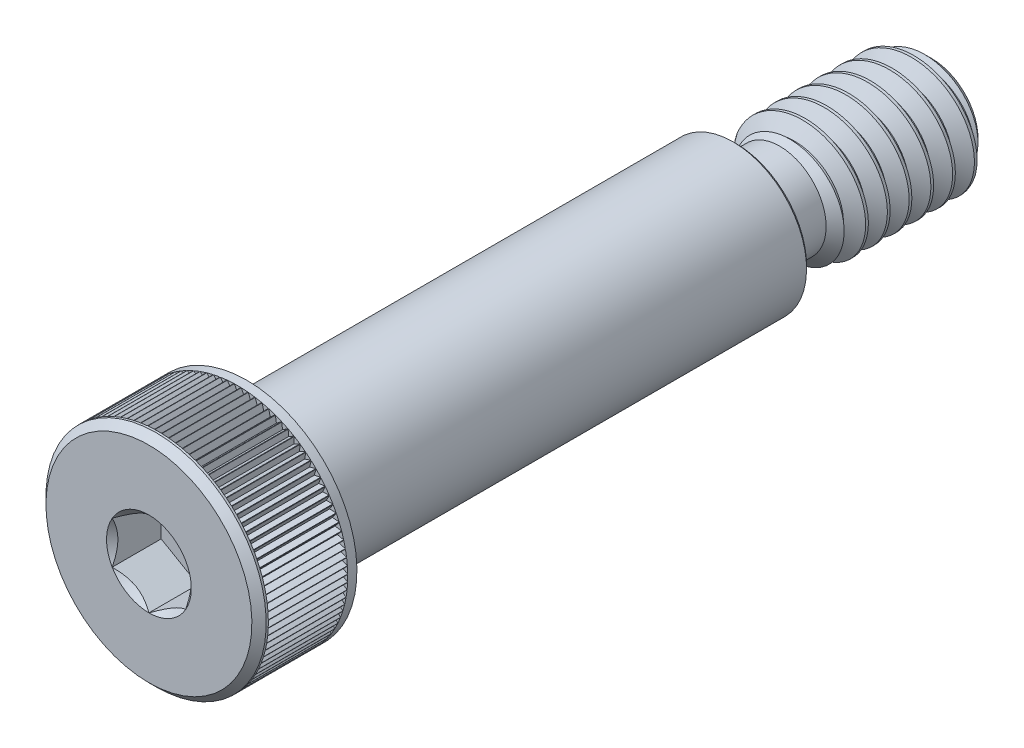
from build123d import *

# Parameters (mm, degrees)
CHAMFER1_SIZE      = 0.993775
CHAMFER2_SIZE      = 0.46434375
CHAMFER3_SIZE      = 0.2032
CUT_EXTRUDE5_DEPTH = 2.575123438
CIRPATTERN1_COUNT  = 99
CUT_EXTRUDE2_DEPTH = 3.175
CUT_SWEEP1_PITCH   = 1.411111111


with BuildPart() as part:
    # Sketch1 → Revolve1 (revolve)
    with BuildSketch(Plane(origin=(0, 0, 0), x_dir=(0, 0, -1), z_dir=(1, 0, 0))):
        Polygon((0, 7.14375), (6.35, 7.14375), (6.35, 4.7625), (38.1, 4.7625), (38.1, 3.9751), (50.8, 3.9751), (50.8, 0), (0, 0), align=None)
    revolve(axis=Axis((0, 0, -50.8), (0, 0, 1)))

    # Sketch5 → Cut-Revolve1 (revolve, cut)
    with BuildSketch(Plane(origin=(0, 0, 0), x_dir=(0, 0, -1), z_dir=(1, 0, 0))):
        with BuildLine():
            Line((38.1, 4.7625), (42.672, 4.7625))
            Line((42.672, 4.7625), (40.9194, 3.0099))
            Line((40.9194, 3.0099), (39.0652, 3.0099))
            ThreePointArc((39.0652, 3.0099), (38.382700535, 3.292600535), (38.1, 3.9751))
            Line((38.1, 3.9751), (38.1, 4.7625))
        make_face()
    revolve(axis=Axis((0, 0, -50.8), (0, 0, 1)), mode=Mode.SUBTRACT)

    # Chamfer1
    chamfer1_edges = [part.edges().sort_by_distance(p)[0] for p in [
        (0, -3.9751, -50.8),
    ]]
    chamfer(chamfer1_edges, length=CHAMFER1_SIZE)

    # Chamfer2
    chamfer2_edges = [part.edges().sort_by_distance(p)[0] for p in [
        (0, -7.14375, 0),
    ]]
    chamfer(chamfer2_edges, length=CHAMFER2_SIZE)

    # Chamfer3
    chamfer3_edges = [part.edges().sort_by_distance(p)[0] for p in [
        (0, -4.7625, -38.1),
    ]]
    chamfer(chamfer3_edges, length=CHAMFER3_SIZE)

    # Sketch11 → Cut-Extrude5 (cut, symmetric)
    with BuildSketch(Plane.XY.offset(-3.175)):
        Polygon((0, 6.772275), (0.214471191, 7.14375), (-0.214471191, 7.14375), align=None)
    cut_extrude5 = extrude(amount=CUT_EXTRUDE5_DEPTH, both=True, mode=Mode.SUBTRACT)

    # CirPattern1: Cut-Extrude5 ×99 about axis
    cirpattern1_axis = Axis((0, 0, 0), (0, 0, 1))
    for i in range(1, CIRPATTERN1_COUNT):
        add(cut_extrude5.rotate(cirpattern1_axis, i * 360 / CIRPATTERN1_COUNT), mode=Mode.SUBTRACT)

    # Sketch8 → Cut-Extrude2 (cut)
    with BuildSketch(Plane.XY):
        Polygon((2.38125, 1.374815329), (0, 2.749630657), (-2.38125, 1.374815329), (-2.38125, -1.374815329), (0, -2.749630657), (2.38125, -1.374815329), align=None)
    extrude(amount=-CUT_EXTRUDE2_DEPTH, mode=Mode.SUBTRACT)

    # Cut-Extrude4 cone 1 section (through the dimple's axis) → Cut-Extrude4 (revolve, cut)
    with BuildSketch(Plane(origin=(0, 0, 0), x_dir=(0, -1, 0), z_dir=(1, 0, 0))):
        Polygon((0, 0), (2.749630657, 0), (0, 2.749630657), align=None)
    revolve(axis=Axis((0, 0, 0), (0, 0, -1)), mode=Mode.SUBTRACT)

    # Cut-Sweep1: the profile of Sketch4 screwed along a right-hand helix of 10 turns, 8 arcs to a turn; built about Z, then put on its axis
    cut_sweep1_z = Axis((0, 0, 0), (0, 0, 1))
    cut_sweep1_corners = [(4.051478629, 0, 0.044097222), (4.051478629, 0, -1.278819444), (3.058556448, 0, -0.705555556), (3.058556448, 0, -0.529166667)]
    with BuildLine(mode=Mode.PRIVATE) as cut_sweep1_profile:
        Line(cut_sweep1_corners[0], cut_sweep1_corners[1])
        Line(cut_sweep1_corners[1], cut_sweep1_corners[2])
        Line(cut_sweep1_corners[2], cut_sweep1_corners[3])
        Line(cut_sweep1_corners[3], cut_sweep1_corners[0])
    cut_sweep1_cap = Face(cut_sweep1_profile.wire())
    cut_sweep1_turn_angles = [0, 22.5, 45, 67.5, 90, 112.5, 135, 157.5, 180, 202.5, 225, 247.5, 270, 292.5, 315, 337.5, 360]
    cut_sweep1_turn_weights = [1, 0.9238795325112867, 1, 0.9238795325112867, 1, 0.9238795325112867, 1, 0.9238795325112867, 1, 0.9238795325112867, 1, 0.9238795325112867, 1, 0.9238795325112867, 1, 0.9238795325112867, 1]
    cut_sweep1_turn_rails = [Edge.make_bspline([Vector(p[0], p[1], 0).rotate(cut_sweep1_z, cut_sweep1_turn_angles[k]) / cut_sweep1_turn_weights[k] + Vector(0, 0, p[2] + CUT_SWEEP1_PITCH * cut_sweep1_turn_angles[k] / 360) for k in range(17)], [0, 0, 0, 1, 1, 2, 2, 3, 3, 4, 4, 5, 5, 6, 6, 7, 7, 8, 8, 8], 2, cut_sweep1_turn_weights) for p in cut_sweep1_corners]
    cut_sweep1_turn_sides = [Face.make_surface_from_curves(cut_sweep1_turn_rails[p[0]], cut_sweep1_turn_rails[p[1]]) for p in [(0, 1), (1, 2), (2, 3), (3, 0)]]
    cut_sweep1 = Plane(origin=(0, 0, -50.8), x_dir=(0, 1, 0), z_dir=(0, 0, 1)) * Solid(Shell([*[p.moved(Location((0, 0, CUT_SWEEP1_PITCH * i))) for i in range(10) for p in cut_sweep1_turn_sides], cut_sweep1_cap, cut_sweep1_cap.rotate(cut_sweep1_z, 3600).moved(Location((0, 0, CUT_SWEEP1_PITCH * 3600 / 360)))]))
    add(cut_sweep1, mode=Mode.SUBTRACT)

    # Sketch12 → Revolve2 (revolve)
    with BuildSketch(Plane(origin=(0, 0, 0), x_dir=(0, 0, -1), z_dir=(1, 0, 0)), mode=Mode.PRIVATE) as revolve2_sk:
        with BuildLine():
            Line((38.1, 4.5593), (37.8968, 4.7625))
            Line((37.8968, 4.7625), (6.35, 4.7625))
            Line((6.35, 4.7625), (6.35, 0))
            Line((6.35, 0), (38.1, 0))
            Line((38.1, 0), (40.9194, 0))
            Line((40.9194, 0), (40.9194, 3.0099))
            Line((40.9194, 3.0099), (39.0652, 3.0099))
            ThreePointArc((39.0652, 3.0099), (38.382700535, 3.292600535), (38.1, 3.9751))
            Line((38.1, 3.9751), (38.1, 4.5593))
        make_face()
    revolve(revolve2_sk.sketch.rotate(Axis((0, 0, -6.35), (0, 0, -1)), 160.226555092), axis=Axis((0, 0, -6.35), (0, 0, -1)))


solid = part.part
